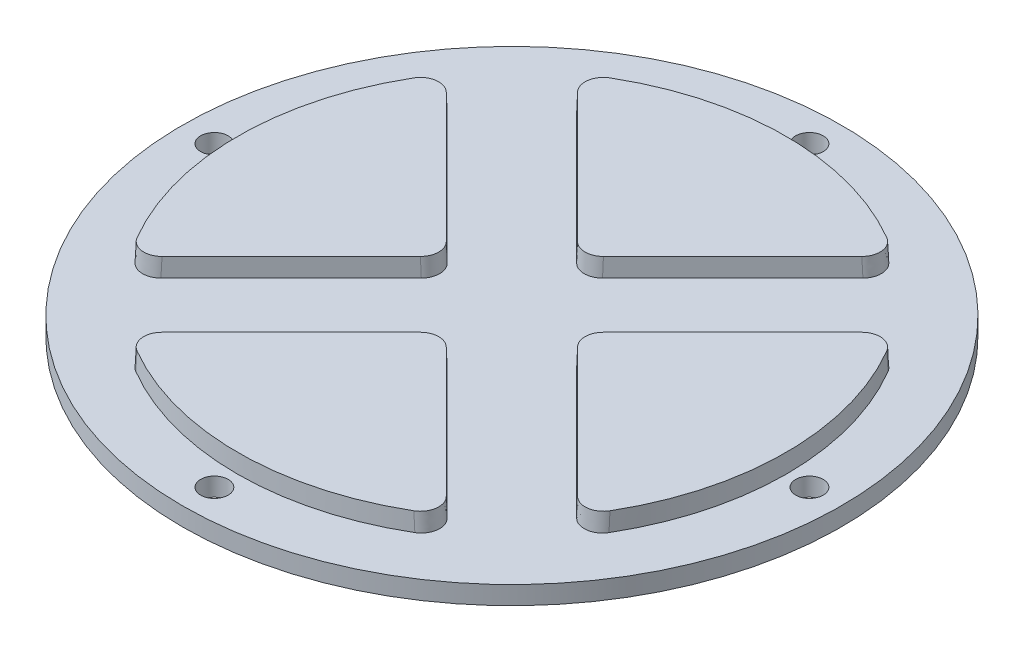
from build123d import *

# Parameters (mm, degrees)
SKETCH_1_R                = 18
EXTRUDE_1_DEPTH           = 1
EXTRUDE_2_DEPTH           = 1
EXTRUDE_2_DRAFT           = 2
EXTRUDE_2_PROFILE_2_DEPTH = 1
EXTRUDE_2_PROFILE_2_DRAFT = 2
EXTRUDE_2_PROFILE_3_DEPTH = 1
EXTRUDE_2_PROFILE_3_DRAFT = 2
EXTRUDE_2_PROFILE_4_DEPTH = 1
EXTRUDE_2_PROFILE_4_DRAFT = 2
FILLET_1_R                = 1
SKETCH_3_R                = 0.75
CUT_EXTRUDE_1_DEPTH       = 1
SHELL_1_DEPTH             = 1
SHELL_1_DRAFT             = 2
SHELL_1_2_DEPTH           = 1
SHELL_1_2_DRAFT           = 2
SHELL_1_3_DEPTH           = 1
SHELL_1_3_DRAFT           = 2
SHELL_1_4_DEPTH           = 1
SHELL_1_4_DRAFT           = 2


# Read off the part's stored shape, not the designer's step: Оболочка1
with BuildPart() as part:
    # Эскиз1 → Бобышка-Вытянуть1 (new body)
    with BuildSketch(Plane(origin=(0, 0, 0), x_dir=(1, 0, 0), z_dir=(0, 1, 0))):
        with Locations(Location((0, 0, 0), (0, 0, 270))):
            Circle(SKETCH_1_R)
    extrude(amount=EXTRUDE_1_DEPTH)


with BuildPart() as extrude_2_tool:
    # Эскиз2 → Бобышка-Вытянуть2 (with draft: the straight prism first)
    with BuildSketch(Plane(origin=(0, 1, 0), x_dir=(-1, 0, 0), z_dir=(0, 1, 0))):
        with BuildLine():
            ThreePointArc((-12.226017285, 8.690483379), (-15, 0), (-12.226017285, -8.690483379))
            Line((-12.226017285, -8.690483379), (-3.535533906, 0))
            Line((-3.535533906, 0), (-12.226017285, 8.690483379))
        make_face()
    extrude(amount=EXTRUDE_2_DEPTH)
    # Бобышка-Вытянуть2: the draft: its side faces are tilted about the plane it starts from
    extrude_2_sides = [extrude_2_tool.faces().sort_by_distance(p)[0] for p in [
        (15, 1.5, 0),
        (7.880775595, 1.5, -4.345241689),
        (7.880775595, 1.5, 4.345241689),
    ]]
    draft(extrude_2_sides, Plane(origin=(0, 1, 0), x_dir=(-1, 0, 0), z_dir=(0, 1, 0)), EXTRUDE_2_DRAFT)


with BuildPart() as part_1:
    add(part.part)

    # Бобышка-Вытянуть2: add extrude_2_tool
    add(extrude_2_tool.part)


with BuildPart() as extrude_2_profile_2_tool:
    # Эскиз2 → Бобышка-Вытянуть2 profile 2 (with draft: the straight prism first)
    with BuildSketch(Plane(origin=(0, 1, 0), x_dir=(-1, 0, 0), z_dir=(0, 1, 0))):
        with BuildLine():
            Line((0, -3.535533906), (-8.690483379, -12.226017285))
            ThreePointArc((-8.690483379, -12.226017285), (0, -15), (8.690483379, -12.226017285))
            Line((8.690483379, -12.226017285), (0, -3.535533906))
        make_face()
    extrude(amount=EXTRUDE_2_PROFILE_2_DEPTH)
    # Бобышка-Вытянуть2 profile 2: the draft: its side faces are tilted about the plane it starts from
    extrude_2_profile_2_sides = [extrude_2_profile_2_tool.faces().sort_by_distance(p)[0] for p in [
        (-4.345241689, 1.5, -7.880775595),
        (4.345241689, 1.5, -7.880775595),
        (0, 1.5, -15),
    ]]
    draft(extrude_2_profile_2_sides, Plane(origin=(0, 1, 0), x_dir=(-1, 0, 0), z_dir=(0, 1, 0)), EXTRUDE_2_PROFILE_2_DRAFT)


with BuildPart() as part_2:
    add(part_1.part)

    # Бобышка-Вытянуть2 profile 2: add extrude_2_profile_2_tool
    add(extrude_2_profile_2_tool.part)


with BuildPart() as extrude_2_profile_3_tool:
    # Эскиз2 → Бобышка-Вытянуть2 profile 3 (with draft: the straight prism first)
    with BuildSketch(Plane(origin=(0, 1, 0), x_dir=(-1, 0, 0), z_dir=(0, 1, 0))):
        with BuildLine():
            Line((0, 3.535533906), (8.690483379, 12.226017285))
            ThreePointArc((8.690483379, 12.226017285), (0, 15), (-8.690483379, 12.226017285))
            Line((-8.690483379, 12.226017285), (0, 3.535533906))
        make_face()
    extrude(amount=EXTRUDE_2_PROFILE_3_DEPTH)
    # Бобышка-Вытянуть2 profile 3: the draft: its side faces are tilted about the plane it starts from
    extrude_2_profile_3_sides = [extrude_2_profile_3_tool.faces().sort_by_distance(p)[0] for p in [
        (4.345241689, 1.5, 7.880775595),
        (-4.345241689, 1.5, 7.880775595),
        (0, 1.5, 15),
    ]]
    draft(extrude_2_profile_3_sides, Plane(origin=(0, 1, 0), x_dir=(-1, 0, 0), z_dir=(0, 1, 0)), EXTRUDE_2_PROFILE_3_DRAFT)


with BuildPart() as part_3:
    add(part_2.part)

    # Бобышка-Вытянуть2 profile 3: add extrude_2_profile_3_tool
    add(extrude_2_profile_3_tool.part)


with BuildPart() as extrude_2_profile_4_tool:
    # Эскиз2 → Бобышка-Вытянуть2 profile 4 (with draft: the straight prism first)
    with BuildSketch(Plane(origin=(0, 1, 0), x_dir=(-1, 0, 0), z_dir=(0, 1, 0))):
        with BuildLine():
            Line((3.535533906, 0), (12.226017285, -8.690483379))
            ThreePointArc((12.226017285, -8.690483379), (15, 0), (12.226017285, 8.690483379))
            Line((12.226017285, 8.690483379), (3.535533906, 0))
        make_face()
    extrude(amount=EXTRUDE_2_PROFILE_4_DEPTH)
    # Бобышка-Вытянуть2 profile 4: the draft: its side faces are tilted about the plane it starts from
    extrude_2_profile_4_sides = [extrude_2_profile_4_tool.faces().sort_by_distance(p)[0] for p in [
        (-7.880775595, 1.5, 4.345241689),
        (-7.880775595, 1.5, -4.345241689),
        (-15, 1.5, 0),
    ]]
    draft(extrude_2_profile_4_sides, Plane(origin=(0, 1, 0), x_dir=(-1, 0, 0), z_dir=(0, 1, 0)), EXTRUDE_2_PROFILE_4_DRAFT)


with BuildPart() as part_4:
    add(part_3.part)

    # Бобышка-Вытянуть2 profile 4: add extrude_2_profile_4_tool
    add(extrude_2_profile_4_tool.part)

    # Скругление1
    fillet_1_edges = [part_4.edges().sort_by_distance(p)[0] for p in [
        (12.223745015, 1.500000598, 8.663518367),
        (12.223745015, 1.500000598, -8.663518367),
        (3.560226619, 1.5, 0),
        (8.663518367, 1.500000598, -12.223745015),
        (-8.663518367, 1.500000598, -12.223745015),
        (0, 1.5, -3.560226619),
        (-12.223745015, 1.500000598, -8.663518367),
        (-12.223745015, 1.500000598, 8.663518367),
        (-3.560226619, 1.5, 0),
        (-8.663518367, 1.500000598, 12.223745015),
        (8.663518367, 1.500000598, 12.223745015),
        (0, 1.5, 3.560226619),
    ]]
    fillet(fillet_1_edges, radius=FILLET_1_R)

    # Эскиз3 → Вырез-Вытянуть1 (cut)
    with BuildSketch(Plane.XZ):
        with Locations(Location((0, 16.25, 0), (0, 0, 270))):
            Circle(SKETCH_3_R)
        with Locations(Location((-16.25, 0, 0), (0, 0, 270))):
            Circle(SKETCH_3_R)
        with Locations(Location((0, -16.25, 0), (0, 0, 270))):
            Circle(SKETCH_3_R)
        with Locations(Location((16.25, 0, 0), (0, 0, 270))):
            Circle(SKETCH_3_R)
    extrude(amount=-CUT_EXTRUDE_1_DEPTH, mode=Mode.SUBTRACT)


with BuildPart() as shell_1_tool:
    # Оболочка1 outline → Оболочка1 (with draft: the straight prism first)
    with BuildSketch(Plane(origin=(0, 1, 0), x_dir=(1, 0, 0), z_dir=(0, 1, 0))):
        with BuildLine():
            Line((0, -4.950609494), (-7.109283558, -12.059893052))
            ThreePointArc((-7.109283558, -12.059893052), (0, -13.999390456), (7.109283558, -12.059893052))
            Line((7.109283558, -12.059893052), (0, -4.950609494))
        make_face()
    extrude(amount=-SHELL_1_DEPTH)
    # Оболочка1: the draft: its side faces are tilted about the plane it starts from
    shell_1_sides = [shell_1_tool.faces().sort_by_distance(p)[0] for p in [
        (3.554641779, 0.5, 8.505251273),
        (-3.554641779, 0.5, 8.505251273),
        (0, 0.5, 13.999390456),
    ]]
    draft(shell_1_sides, Plane(origin=(0, 1, 0), x_dir=(1, 0, 0), z_dir=(0, 1, 0)), SHELL_1_DRAFT)


with BuildPart() as part_5:
    add(part_4.part)

    # Оболочка1: cut by shell_1_tool
    add(shell_1_tool.part, mode=Mode.SUBTRACT)


with BuildPart() as shell_1_2_tool:
    # Shell 1 2 outline → Shell 1 2 (with draft: the straight prism first)
    with BuildSketch(Plane(origin=(0, 1, 0), x_dir=(1, 0, 0), z_dir=(0, 1, 0))):
        with BuildLine():
            Line((12.059893052, 7.109283558), (4.950609494, 0))
            Line((4.950609494, 0), (12.059893052, -7.109283558))
            ThreePointArc((12.059893052, -7.109283558), (13.999390456, 0), (12.059893052, 7.109283558))
        make_face()
    extrude(amount=-SHELL_1_2_DEPTH)
    # Shell 1 2: the draft: its side faces are tilted about the plane it starts from
    shell_1_2_sides = [shell_1_2_tool.faces().sort_by_distance(p)[0] for p in [
        (8.505251273, 0.5, -3.554641779),
        (8.505251273, 0.5, 3.554641779),
        (13.999390456, 0.5, 0),
    ]]
    draft(shell_1_2_sides, Plane(origin=(0, 1, 0), x_dir=(1, 0, 0), z_dir=(0, 1, 0)), SHELL_1_2_DRAFT)


with BuildPart() as part_6:
    add(part_5.part)

    # Shell 1 2: cut by shell_1_2_tool
    add(shell_1_2_tool.part, mode=Mode.SUBTRACT)


with BuildPart() as shell_1_3_tool:
    # Shell 1 3 outline → Shell 1 3 (with draft: the straight prism first)
    with BuildSketch(Plane(origin=(0, 1, 0), x_dir=(1, 0, 0), z_dir=(0, 1, 0))):
        with BuildLine():
            ThreePointArc((-12.059893052, 7.109283558), (-13.999390456, 0), (-12.059893052, -7.109283558))
            Line((-12.059893052, -7.109283558), (-4.950609494, 0))
            Line((-4.950609494, 0), (-12.059893052, 7.109283558))
        make_face()
    extrude(amount=-SHELL_1_3_DEPTH)
    # Shell 1 3: the draft: its side faces are tilted about the plane it starts from
    shell_1_3_sides = [shell_1_3_tool.faces().sort_by_distance(p)[0] for p in [
        (-13.999390456, 0.5, 0),
        (-8.505251273, 0.5, 3.554641779),
        (-8.505251273, 0.5, -3.554641779),
    ]]
    draft(shell_1_3_sides, Plane(origin=(0, 1, 0), x_dir=(1, 0, 0), z_dir=(0, 1, 0)), SHELL_1_3_DRAFT)


with BuildPart() as part_7:
    add(part_6.part)

    # Shell 1 3: cut by shell_1_3_tool
    add(shell_1_3_tool.part, mode=Mode.SUBTRACT)


with BuildPart() as shell_1_4_tool:
    # Shell 1 4 outline → Shell 1 4 (with draft: the straight prism first)
    with BuildSketch(Plane(origin=(0, 1, 0), x_dir=(1, 0, 0), z_dir=(0, 1, 0))):
        with BuildLine():
            ThreePointArc((7.109283558, 12.059893052), (0, 13.999390456), (-7.109283558, 12.059893052))
            Line((-7.109283558, 12.059893052), (0, 4.950609494))
            Line((0, 4.950609494), (7.109283558, 12.059893052))
        make_face()
    extrude(amount=-SHELL_1_4_DEPTH)
    # Shell 1 4: the draft: its side faces are tilted about the plane it starts from
    shell_1_4_sides = [shell_1_4_tool.faces().sort_by_distance(p)[0] for p in [
        (0, 0.5, -13.999390456),
        (-3.554641779, 0.5, -8.505251273),
        (3.554641779, 0.5, -8.505251273),
    ]]
    draft(shell_1_4_sides, Plane(origin=(0, 1, 0), x_dir=(1, 0, 0), z_dir=(0, 1, 0)), SHELL_1_4_DRAFT)


with BuildPart() as part_8:
    add(part_7.part)

    # Shell 1 4: cut by shell_1_4_tool
    add(shell_1_4_tool.part, mode=Mode.SUBTRACT)


solid = part_8.part
